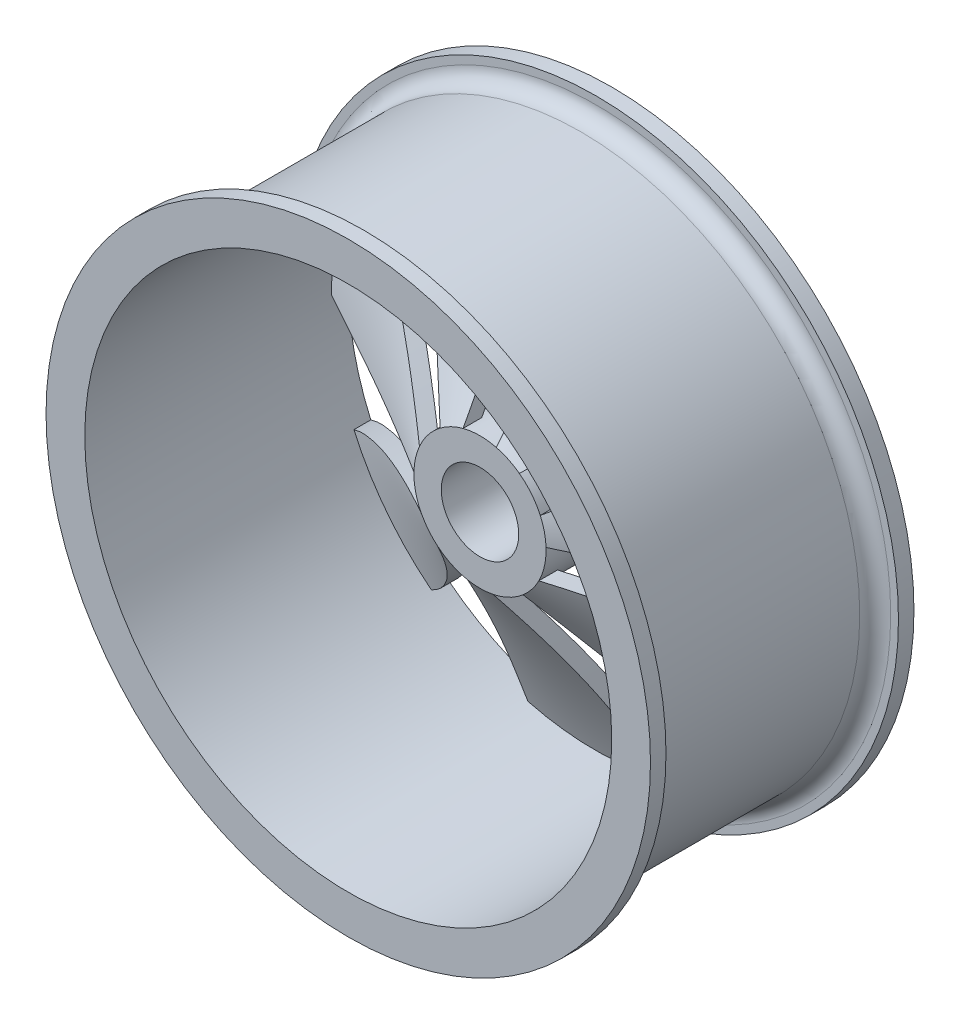
from build123d import *
from build123d.topology import SkipClean

# Parameters (mm, degrees)
SKETCH2_R           = 4.265095018
SKETCH2_R_2         = 2.5
BOSS_EXTRUDE1_DEPTH = 5
SKETCH3_R           = 4.265095018
BOSS_EXTRUDE3_DEPTH = 1
CUT_EXTRUDE1_DEPTH  = 33.395987406
CIRPATTERN8_COUNT   = 7
FILLET2_R           = 1


# Read off the part's stored shape, not the designer's step: Revolve1
with BuildPart() as part:
    # Revolve1 outline → Revolve1 (revolve)
    with BuildSketch(Plane.XZ):
        with BuildLine():
            Line((17, -8.5), (19.5, -8.5))
            Line((19.5, -8.5), (19.5, -7.5))
            Line((19.5, -7.5), (19, -7.5))
            ThreePointArc((19, -7.5), (18.292893219, -7.207106781), (18, -6.5))
            Line((18, -6.5), (18, 6.5))
            ThreePointArc((18, 6.5), (18.292893219, 7.207106781), (19, 7.5))
            Line((19, 7.5), (19.5, 7.5))
            Line((19.5, 7.5), (19.5, 8.5))
            Line((19.5, 8.5), (17, 8.5))
            Line((17, 8.5), (16.999999999, -7.410509831))
            add(Edge.make_bspline(
                [(16.999999999, -7.410509831), (16.891095834, -7.362686638), (16.542121265, -7.207491769), (15.682014681, -6.810667024), (13.865183363, -5.912499269), (11.030775296, -4.347429391), (7.892397781, -2.41147845), (5.573328063, -0.885635516), (4.574453507, -0.21067854), (4.265095018, 0)],
                knots=[0.034049606, 0.034049606, 0.034049606, 0.034049606, 0.0625, 0.125, 0.25, 0.5, 0.75, 0.875, 0.929949803, 0.929949803, 0.929949803, 0.929949803], degree=3))
            Line((4.265095018, 0), (2.5, 0))
            add(Edge.make_bspline(
                [(2.5, 0), (8.285672377, -4.0146218), (13.11900571, -6.847955133), (17, -8.5)],
                knots=[0.896544804, 0.896544804, 0.896544804, 0.896544804, 1.896544804, 1.896544804, 1.896544804, 1.896544804], degree=3))
        make_face()
    revolve(axis=Axis((0, 0, 0), (0, 0, 1)))

    # Sketch2 → Boss-Extrude1 (add)
    with BuildSketch(Plane.XY):
        Circle(SKETCH2_R)
        Circle(SKETCH2_R_2, mode=Mode.SUBTRACT)
    extrude(amount=-BOSS_EXTRUDE1_DEPTH)

    # Sketch3 → Boss-Extrude3 (add)
    with BuildSketch(Plane(origin=(0, 0, -5), x_dir=(-1, 0, 0), z_dir=(0, 0, -1))):
        with Locations(Location((0, 0, 0), (0, 0, 180))):
            Circle(SKETCH3_R)
    extrude(amount=BOSS_EXTRUDE3_DEPTH)

    # Sketch4 → Cut-Extrude1 (cut, through all)
    with SkipClean():  # the faces are left unmerged after this step: merging them gives an invalid solid
        with BuildSketch(Plane(origin=(0, 0, -8.5), x_dir=(-1, 0, 0), z_dir=(0, 0, -1))):
            with BuildLine():
                ThreePointArc((3.244784205, 16.687461624), (-0.242707742, 16.998267351), (-3.719904178, 16.588017148))
                add(Edge.make_bspline(
                    [(-1.053874728, 4.13284207), (-1.685577264, 12.721350771), (-3.719904178, 16.588017148)],
                    knots=[0, 0, 0, 1, 1, 1], degree=2))
                ThreePointArc((-1.053874728, 4.13284207), (0.021220143, 4.26504223), (1.094946333, 4.1221509))
                add(Edge.make_bspline(
                    [(1.094946333, 4.1221509), (1.869631996, 13.189410407), (3.244784205, 16.687461624)],
                    knots=[0, 0, 0, 1, 1, 1], degree=2))
            make_face()
        cut_extrude1 = extrude(amount=-CUT_EXTRUDE1_DEPTH, mode=Mode.SUBTRACT)

    # CirPattern8: Cut-Extrude1 ×7 about axis
    cirpattern8_axis = Axis((0, 0, 0), (0, 0, -1))
    for i in range(1, CIRPATTERN8_COUNT):
        add(cut_extrude1.rotate(cirpattern8_axis, i * 360 / CIRPATTERN8_COUNT), mode=Mode.SUBTRACT)

    # Fillet2
    fillet2_edges = [part.edges().sort_by_distance(p)[0] for p in [
        (-4.15338679, -0.96974929, -6),
    ]]
    fillet(fillet2_edges, radius=FILLET2_R)


solid = part.part
